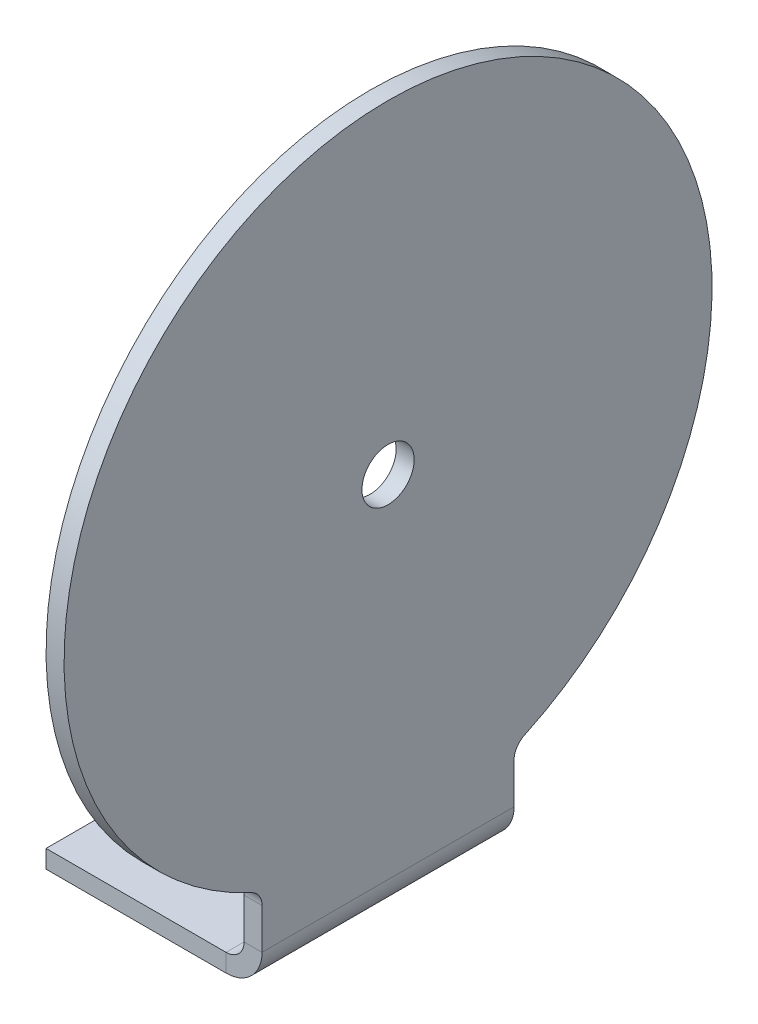
from build123d import *

# Parameters (mm, degrees)
ESBO_O1_W                      = 60
ESBO_O1_H                      = 70
FLANGE_BASE1_DEPTH             = 5
ARESTA_FLANGE1_STRIP_W         = 30
ARESTA_FLANGE1_STRIP_H         = 5
ARESTA_FLANGE1_STRIP_CUT_DEPTH = 70
ARESTA_FLANGE1_DEPTH           = 70
ESBO_O9_R                      = 90
ABA1_DEPTH                     = 5
FILETE5_R                      = 5
FILETE6_R                      = 5
ESBO_O10_R                     = 7.25
CORTE_EXTRUS_O1_DEPTH          = 5


# Sheet-metal steps are written as plain solids
with BuildPart() as part:
    # Esboço1 → Flange-base1 (new body)
    with BuildSketch(Plane(origin=(0, 0, 0), x_dir=(1, 0, 0), z_dir=(0, 1, 0))):
        Rectangle(ESBO_O1_W, ESBO_O1_H)
    extrude(amount=-FLANGE_BASE1_DEPTH)

    # Aresta-Flange1 strip (across the edge) → Aresta-Flange1 strip cut (cut)
    with BuildSketch(Plane(origin=(30, 0, 35), x_dir=(-1, 0, 0), z_dir=(0, 0, -1))):
        with Locations((-5, -2.5)):
            Rectangle(ARESTA_FLANGE1_STRIP_W, ARESTA_FLANGE1_STRIP_H)
    extrude(amount=ARESTA_FLANGE1_STRIP_CUT_DEPTH, mode=Mode.SUBTRACT)

    # Aresta-Flange1 section (across the edge) → Aresta-Flange1 (add)
    with BuildSketch(Plane(origin=(30, 0, 35), x_dir=(-1, 0, 0), z_dir=(0, 0, -1))):
        with BuildLine():
            Line((0, 5), (0, 86))
            Line((0, 86), (5, 86))
            Line((5, 86), (5, 5))
            ThreePointArc((5, 5), (6.464466094, 1.464466094), (10, 0))
            Line((10, 0), (10, -5))
            ThreePointArc((10, -5), (2.928932188, -2.071067812), (0, 5))
        make_face()
    extrude(amount=ARESTA_FLANGE1_DEPTH)

    # Esboço9 → Aba1 (add)
    with BuildSketch(Plane(origin=(30, 0, 0), x_dir=(0, 0, -1), z_dir=(1, 0, 0))):
        with Locations((0, 102.425)):
            Circle(ESBO_O9_R)
    extrude(amount=-ABA1_DEPTH)

    # Filete5
    filete5_edges = [part.edges().sort_by_distance(p)[0] for p in [
        (27.5, 19.509380241, -35),
    ]]
    fillet(filete5_edges, radius=FILETE5_R)

    # Filete6
    filete6_edges = [part.edges().sort_by_distance(p)[0] for p in [
        (27.5, 19.509380241, 35),
    ]]
    fillet(filete6_edges, radius=FILETE6_R)

    # Esboço10 → Corte-extrusão1 (cut)
    with BuildSketch(Plane(origin=(30, 0, 0), x_dir=(0, 0, -1), z_dir=(1, 0, 0))):
        with Locations(Location((0, 102.425, 0), (0, 0, 90))):
            Circle(ESBO_O10_R)
    extrude(amount=-CORTE_EXTRUS_O1_DEPTH, mode=Mode.SUBTRACT)


solid = part.part
